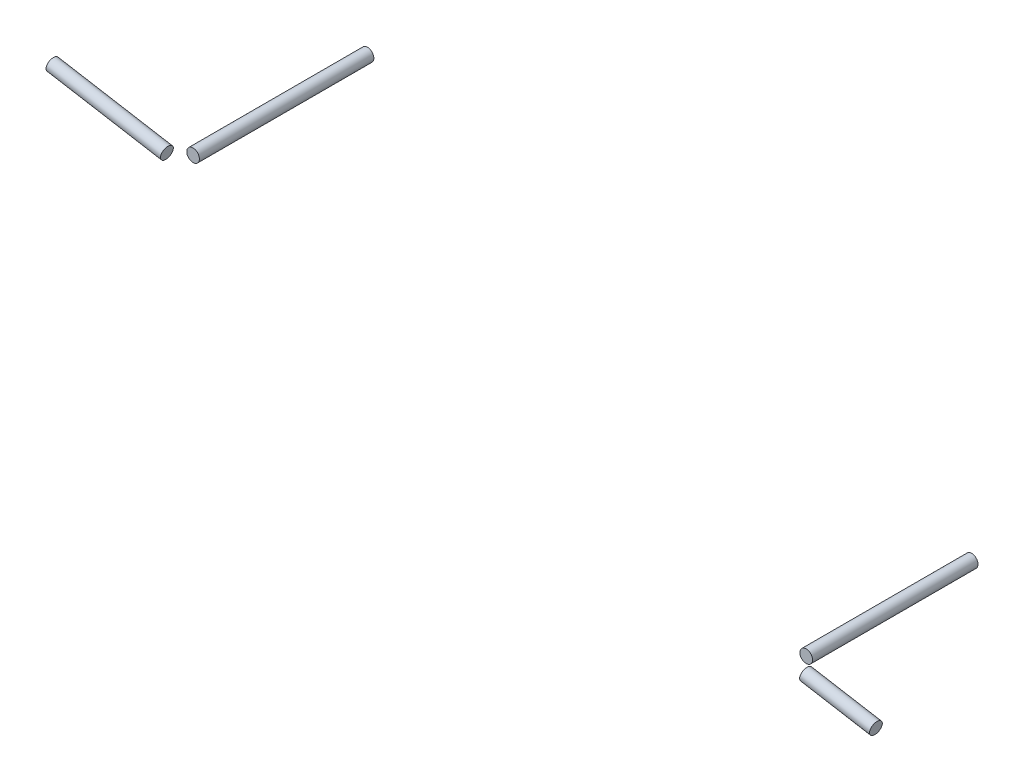
from build123d import *

# Parameters (mm, degrees)
BOSS_EXTRUDE1_START     = -71.1581
BOSS_EXTRUDE1_OUTLINE_R = 6.35
BOSS_EXTRUDE1_DEPTH     = 71.1581
SKETCH3_R               = 6.35
BOSS_EXTRUDE2_DEPTH     = 165.984127761
SKETCH5_R               = 6.35
BOSS_EXTRUDE3_DEPTH     = 116.535086485
SKETCH6_R               = 6.35
BOSS_EXTRUDE4_DEPTH     = 174.975611915


# Read off the part's stored shape, not the designer's step: Boss-Extrude1
with BuildPart() as part:
    # Boss-Extrude1 outline → Boss-Extrude1 (new body)
    with BuildSketch(Plane(origin=(13.018306404, -2.230462367, 0), x_dir=(0.16887207501251916, 0.9856379772923556, 0), z_dir=(-0.9856379772923557, 0.16887207501251916, 0)).offset(BOSS_EXTRUDE1_START)):
        with Locations((0, -156.332127761)):
            Circle(BOSS_EXTRUDE1_OUTLINE_R)
    extrude(amount=BOSS_EXTRUDE1_DEPTH)


with BuildPart() as body_2:
    # Sketch3 → Boss-Extrude2 (new body)
    with BuildSketch(Plane.XY.offset(143.124127761)):
        Circle(SKETCH3_R)
    extrude(amount=-BOSS_EXTRUDE2_DEPTH)


with BuildPart() as body_3:
    # Sketch5 → Boss-Extrude3 (new body)
    with BuildSketch(Plane(origin=(-746.587354672, 127.914872059, 0), x_dir=(0.1688720750125156, 0.9856379772923564, -3.034930787787326e-15), z_dir=(-0.9856379772923564, 0.1688720750125156, 1.2809329124968532e-15))):
        with Locations(Location((21.951296195, -156.332127761, 0), (0, 0, 180))):
            Circle(SKETCH5_R)
    extrude(amount=-BOSS_EXTRUDE3_DEPTH)


with BuildPart() as body_4:
    # Sketch6 → Boss-Extrude4 (new body)
    with BuildSketch(Plane.XY.offset(143.124127761)):
        with Locations((-615.000680403, 127.640919006)):
            Circle(SKETCH6_R)
    extrude(amount=-BOSS_EXTRUDE4_DEPTH)


solid = Compound([part.part, body_2.part, body_3.part, body_4.part])
